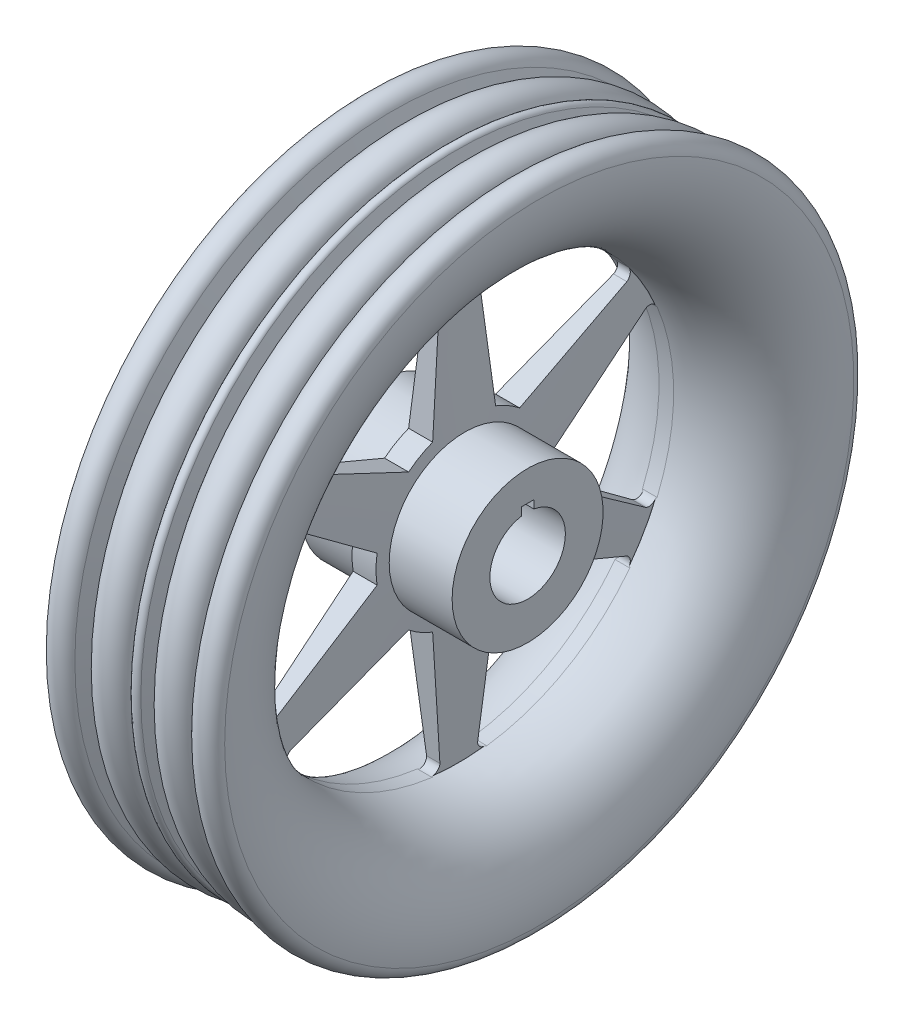
from build123d import *

# Parameters (mm, degrees)
REVOLVE1_2_OUTLINE_R    = 7.721659833
REVOLVE1_3_OUTLINE_R    = 7.721659833
CUT_EXTRUDE8_DEPTH      = 188.14967288
CUT_EXTRUDE8_DEPTH_BACK = 220
SKETCH4_W               = 5
SKETCH4_H               = 6
CUT_EXTRUDE9_DEPTH      = 196.000000167


# Read off the part's stored shape, not the designer's step: Revolve1
with BuildPart() as part:
    # Revolve1 outline → Revolve1 (revolve)
    with BuildSketch(Plane.YX):
        with BuildLine():
            ThreePointArc((125.020233428, -34.638089675), (129.955085587, -29.605815811), (126.411138359, -23.513444835))
            Line((126.411138359, -23.513444835), (104.283215465, -14.347759065))
            ThreePointArc((104.283215465, -14.347759065), (103.04858233, -12.5), (104.283215465, -10.652240935))
            Line((104.283215465, -10.652240935), (125.539115005, -1.847759065))
            ThreePointArc((125.539115005, -1.847759065), (126.77374814, 0), (125.539115005, 1.847759065))
            Line((125.539115005, 1.847759065), (104.283215465, 10.652240935))
            ThreePointArc((104.283215465, 10.652240935), (103.04858233, 12.5), (104.283215465, 14.347759065))
            Line((104.283215465, 14.347759065), (126.411138359, 23.513444835))
            ThreePointArc((126.411138359, 23.513444835), (129.955085587, 29.605815811), (125.020233428, 34.638089675))
            ThreePointArc((125.020233428, 34.638089675), (98.054612271, 27.265361862), (85.089285714, 2.498405104))
            ThreePointArc((85.089285714, 2.498405104), (85.044649979, 2.499601244), (85, 2.5))
            Line((85, 2.5), (30, 5))
            Line((30, 5), (30, 30))
            Line((30, 30), (15, 30))
            Line((15, 30), (15, -30))
            Line((15, -30), (30, -30))
            Line((30, -30), (30, -5))
            Line((30, -5), (85, -2.5))
            ThreePointArc((85, -2.5), (85.044649979, -2.499601244), (85.089285714, -2.498405104))
            ThreePointArc((85.089285714, -2.498405104), (98.054612271, -27.265361862), (125.020233428, -34.638089675))
        make_face()
    revolve(axis=Axis((0, 0, 0), (1, 0, 0)))

    # Sketch2 → Cut-Extrude8 (cut, two sides: drawn at the far end of the back side and taken through both)
    with BuildSketch(Plane(origin=(0, 0, 0), x_dir=(0, 0, -1), z_dir=(1, 0, 0)).offset(-CUT_EXTRUDE8_DEPTH_BACK)):
        with BuildLine():
            Line((66.786021893, 47.219181756), (22.054384515, 27.17727219))
            ThreePointArc((22.054384515, 27.17727219), (17.5, 30.310889132), (12.509015864, 32.68829335))
            Line((12.509015864, 32.68829335), (7.5, 81.447982455))
            ThreePointArc((7.5, 81.447982455), (8.518930451, 83.700839184), (10.883575628, 84.423359698))
            ThreePointArc((10.883575628, 84.423359698), (42.561002929, 73.717819493), (67.670986357, 51.637132827))
            ThreePointArc((67.670986357, 51.637132827), (68.227587826, 49.228029776), (66.786021893, 47.219181756))
        make_face()
        with BuildLine():
            Line((74.286021893, 34.228800699), (34.563400379, 5.51102116))
            ThreePointArc((34.563400379, 5.51102116), (35, 0), (34.563400379, -5.51102116))
            Line((34.563400379, -5.51102116), (74.286021893, -34.228800699))
            ThreePointArc((74.286021893, -34.228800699), (76.746518277, -34.472809408), (78.554561985, -32.786226871))
            ThreePointArc((78.554561985, -32.786226871), (85.122005857, 0), (78.554561985, 32.786226871))
            ThreePointArc((78.554561985, 32.786226871), (76.746518277, 34.472809408), (74.286021893, 34.228800699))
        make_face()
        with BuildLine():
            Line((66.786021893, -47.219181756), (22.054384515, -27.17727219))
            ThreePointArc((22.054384515, -27.17727219), (17.5, -30.310889132), (12.509015864, -32.68829335))
            Line((12.509015864, -32.68829335), (7.5, -81.447982455))
            ThreePointArc((7.5, -81.447982455), (8.518930451, -83.700839184), (10.883575628, -84.423359698))
            ThreePointArc((10.883575628, -84.423359698), (42.561002929, -73.717819493), (67.670986357, -51.637132827))
            ThreePointArc((67.670986357, -51.637132827), (68.227587826, -49.228029776), (66.786021893, -47.219181756))
        make_face()
        with BuildLine():
            Line((-7.5, 81.447982455), (-12.509015864, 32.68829335))
            ThreePointArc((-12.509015864, 32.68829335), (-17.5, 30.310889132), (-22.054384515, 27.17727219))
            Line((-22.054384515, 27.17727219), (-66.786021893, 47.219181756))
            ThreePointArc((-66.786021893, 47.219181756), (-68.227587826, 49.228029776), (-67.670986357, 51.637132827))
            ThreePointArc((-67.670986357, 51.637132827), (-42.561002929, 73.717819493), (-10.883575628, 84.423359698))
            ThreePointArc((-10.883575628, 84.423359698), (-8.518930451, 83.700839184), (-7.5, 81.447982455))
        make_face()
        with BuildLine():
            Line((-7.5, -81.447982455), (-12.509015864, -32.68829335))
            ThreePointArc((-12.509015864, -32.68829335), (-17.5, -30.310889132), (-22.054384515, -27.17727219))
            Line((-22.054384515, -27.17727219), (-66.786021893, -47.219181756))
            ThreePointArc((-66.786021893, -47.219181756), (-68.227587826, -49.228029776), (-67.670986357, -51.637132827))
            ThreePointArc((-67.670986357, -51.637132827), (-42.561002929, -73.717819493), (-10.883575628, -84.423359698))
            ThreePointArc((-10.883575628, -84.423359698), (-8.518930451, -83.700839184), (-7.5, -81.447982455))
        make_face()
        with BuildLine():
            Line((-74.286021893, -34.228800699), (-34.563400379, -5.51102116))
            ThreePointArc((-34.563400379, -5.51102116), (-35, 0), (-34.563400379, 5.51102116))
            Line((-34.563400379, 5.51102116), (-74.286021893, 34.228800699))
            ThreePointArc((-74.286021893, 34.228800699), (-76.746518277, 34.472809408), (-78.554561985, 32.786226871))
            ThreePointArc((-78.554561985, 32.786226871), (-85.122005857, 0), (-78.554561985, -32.786226871))
            ThreePointArc((-78.554561985, -32.786226871), (-76.746518277, -34.472809408), (-74.286021893, -34.228800699))
        make_face()
    extrude(amount=CUT_EXTRUDE8_DEPTH + CUT_EXTRUDE8_DEPTH_BACK, mode=Mode.SUBTRACT)

    # Sketch4 → Cut-Extrude9 (cut, through all)
    with BuildSketch(Plane.ZY.offset(30)):
        with Locations((0, 15)):
            Rectangle(SKETCH4_W, SKETCH4_H)
    extrude(amount=-CUT_EXTRUDE9_DEPTH, mode=Mode.SUBTRACT)


with BuildPart() as body_2:
    # Revolve1 2 outline → Revolve1 2 (revolve)
    with BuildSketch(Plane.YX):
        with Locations((120, 12.5)):
            Circle(REVOLVE1_2_OUTLINE_R)
    revolve(axis=Axis((0, 0, 0), (1, 0, 0)))


with BuildPart() as body_3:
    # Revolve1 3 outline → Revolve1 3 (revolve)
    with BuildSketch(Plane.YX):
        with Locations((120, -12.5)):
            Circle(REVOLVE1_3_OUTLINE_R)
    revolve(axis=Axis((0, 0, 0), (1, 0, 0)))


solid = Compound([part.part, body_2.part, body_3.part])
